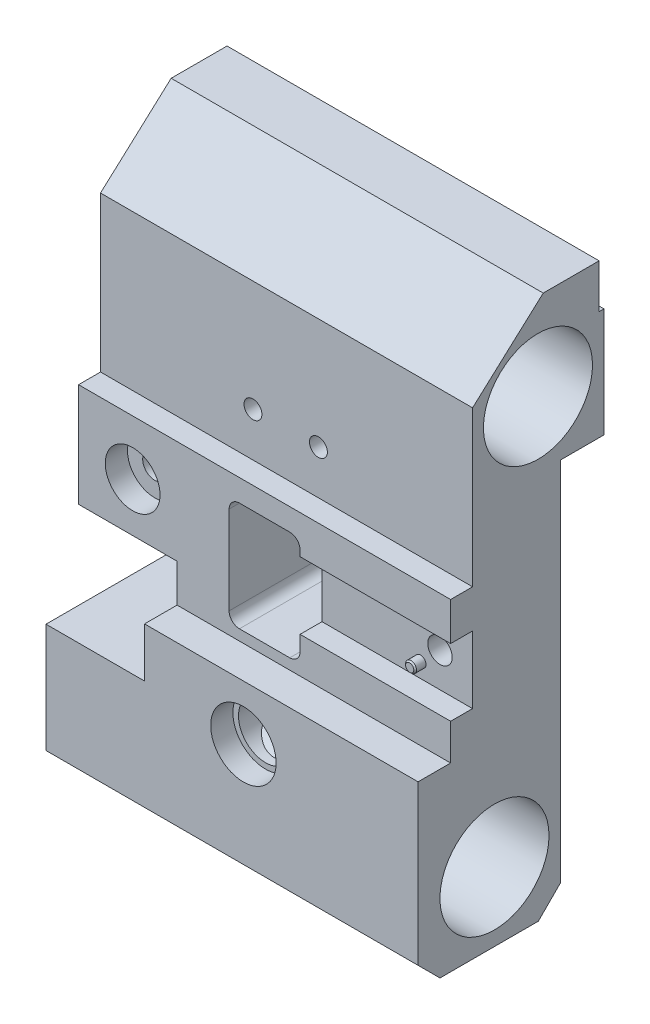
from build123d import *

# Parameters (mm, degrees)
BOSS_EXTRUDE1_DEPTH      = 54
BOSS_EXTRUDE1_DEPTH_BACK = 54
SKETCH1_R                = 15.83
SKETCH2_R                = 7.875
SKETCH2_R_2              = 2.6
SKETCH2_R_3              = 3.525
SKETCH2_R_4              = 3.55
SKETCH2_W                = 28.6
SKETCH2_H                = 25.4
CUT_EXTRUDE1_DEPTH       = 154.113939274
SKETCH3_W                = 43.7
SKETCH3_H                = 19.52
CUT_EXTRUDE2_DEPTH       = 6.36
SKETCH4_R                = 1.585
BOSS_EXTRUDE2_DEPTH      = 3.15
SKETCH10_R               = 1.585
CUT_EXTRUDE6_DEPTH       = 20
SKETCH11_R               = 5.5
SKETCH11_R_2             = 3.525
SKETCH11_R_3             = 5.42
CUT_EXTRUDE7_DEPTH       = 6.56
CHAMFER1_SIZE            = 0.4
SKETCH5_R                = 7.945
CUT_EXTRUDE3_DEPTH       = 6.44
SKETCH6_R                = 9.495
CUT_EXTRUDE4_DEPTH       = 6.44
SKETCH7_W                = 8.77
SKETCH7_H                = 34.96
BOSS_EXTRUDE3_DEPTH      = 3.1
SKETCH8_R                = 2
CUT_EXTRUDE5_DEPTH       = 15
SKETCH11_3_R             = 4.55
SKETCH11_3_R_2           = 2.6
CUT_EXTRUDE8_DEPTH       = 5.45
SKETCH12_R               = 9.475
CUT_EXTRUDE9_DEPTH       = 5.15
SKETCH13_R               = 2
CUT_EXTRUDE10_DEPTH      = 10
SKETCH14_R               = 2
CUT_EXTRUDE11_DEPTH      = 10


with BuildPart() as part:
    # Sketch1 → Boss-Extrude1 (new, two sides: drawn at the far end of the back side and taken through both)
    with BuildSketch(Plane(origin=(0, 0, 0), x_dir=(0, 0, -1), z_dir=(1, 0, 0)).offset(-BOSS_EXTRUDE1_DEPTH_BACK)):
        Polygon((14.15, 137.2), (30.37, 137.2), (30.37, 124.41), (31.79, 124.41), (31.79, 92.72), (19.1, 92.72), (19.1, -13.636038969), (12.736038969, -20), (-15.816038969, -20), (-22.18, -13.636038969), (-22.18, 32.5), (-12.73, 32.5), (-12.73, 73.61), (-6.36, 73.61), (-6.36, 118.61), align=None)
        Circle(SKETCH1_R, mode=Mode.SUBTRACT)
        with Locations((12.625, 111.985)):
            Circle(SKETCH1_R, mode=Mode.SUBTRACT)
    extrude(amount=BOSS_EXTRUDE1_DEPTH + BOSS_EXTRUDE1_DEPTH_BACK)

    # Sketch2 → Cut-Extrude1 (cut, through all)
    with BuildSketch(Plane(origin=(0, 0, -19.1), x_dir=(-1, 0, 0), z_dir=(0, 0, -1))):
        with Locations((-3.3, 16.595)):
            Circle(SKETCH2_R)
        with Locations((-9.25, 86.37)):
            Circle(SKETCH2_R_2)
        with Locations((9.75, 86.37)):
            Circle(SKETCH2_R_2)
        with Locations((38.3, 57.72)):
            Circle(SKETCH2_R_3)
        with Locations((-44.55, 52.92)):
            Circle(SKETCH2_R_4)
        with BuildLine():
            Line((-7.3, 67.2), (7.3, 67.2))
            ThreePointArc((7.3, 67.2), (9.421320344, 66.321320344), (10.3, 64.2))
            Line((10.3, 64.2), (10.3, 38.6))
            ThreePointArc((10.3, 38.6), (9.421320344, 36.478679656), (7.3, 35.6))
            Line((7.3, 35.6), (-7.3, 35.6))
            ThreePointArc((-7.3, 35.6), (-9.421320344, 36.478679656), (-10.3, 38.6))
            Line((-10.3, 38.6), (-10.3, 64.2))
            ThreePointArc((-10.3, 64.2), (-9.421320344, 66.321320344), (-7.3, 67.2))
        make_face()
        with Locations((39.7, 30.83)):
            Rectangle(SKETCH2_W, SKETCH2_H)
    extrude(amount=-CUT_EXTRUDE1_DEPTH, mode=Mode.SUBTRACT)

    # Sketch3 → Cut-Extrude2 (cut)
    with BuildSketch(Plane.XY.offset(12.73)):
        with Locations((32.15, 52.76)):
            Rectangle(SKETCH3_W, SKETCH3_H)
    extrude(amount=-CUT_EXTRUDE2_DEPTH, mode=Mode.SUBTRACT)

    # Sketch4 → Boss-Extrude2 (add)
    with BuildSketch(Plane.XY.offset(6.37)):
        with Locations((38.915, 47.335)):
            Circle(SKETCH4_R)
    extrude(amount=BOSS_EXTRUDE2_DEPTH)

    # Sketch10 → Cut-Extrude6 (cut)
    with BuildSketch(Plane(origin=(0, 0, -19.1), x_dir=(-1, 0, 0), z_dir=(0, 0, -1))):
        with Locations((-38.915, 47.335)):
            Circle(SKETCH10_R)
    extrude(amount=-CUT_EXTRUDE6_DEPTH, mode=Mode.SUBTRACT)

    # Sketch11 → Cut-Extrude7 (cut)
    # profile 1 of 2: a face of its own
    with BuildSketch(Plane(origin=(0, 0, -19.1), x_dir=(-1, 0, 0), z_dir=(0, 0, -1))):
        with Locations((38.3, 57.72)):
            Circle(SKETCH11_R)
        with Locations((38.3, 57.72)):
            Circle(SKETCH11_R_2, mode=Mode.SUBTRACT)
    # profile 2 of 2: a face of its own
    with BuildSketch(Plane(origin=(0, 0, -19.1), x_dir=(-1, 0, 0), z_dir=(0, 0, -1))):
        with Locations((-44.55, 52.92)):
            Circle(SKETCH11_R_3)
    extrude(amount=-CUT_EXTRUDE7_DEPTH, mode=Mode.SUBTRACT)

    # Chamfer1
    chamfer1_edges = [part.edges().sort_by_distance(p)[0] for p in [
        (37.33, 47.335, 9.52),
    ]]
    chamfer(chamfer1_edges, length=CHAMFER1_SIZE)

    # Sketch5 → Cut-Extrude3 (cut)
    with BuildSketch(Plane.XY.offset(12.73)):
        with Locations((-38.3, 57.72)):
            Circle(SKETCH5_R)
    extrude(amount=-CUT_EXTRUDE3_DEPTH, mode=Mode.SUBTRACT)

    # Sketch6 → Cut-Extrude4 (cut)
    with BuildSketch(Plane.XY.offset(22.18)):
        with Locations((3.3, 16.595)):
            Circle(SKETCH6_R)
    extrude(amount=-CUT_EXTRUDE4_DEPTH, mode=Mode.SUBTRACT)

    # Sketch7 → Boss-Extrude3 (add)
    with BuildSketch(Plane(origin=(0, 0, -19.1), x_dir=(-1, 0, 0), z_dir=(0, 0, -1))):
        with Locations((21.015, 16.59)):
            Rectangle(SKETCH7_W, SKETCH7_H)
    extrude(amount=BOSS_EXTRUDE3_DEPTH)

    # Sketch8 → Cut-Extrude5 (cut)
    with BuildSketch(Plane(origin=(0, 0, -22.2), x_dir=(-1, 0, 0), z_dir=(0, 0, -1))):
        with Locations((21.4, 29.135)):
            Circle(SKETCH8_R)
        with Locations((21.4, 3.82)):
            Circle(SKETCH8_R)
    extrude(amount=-CUT_EXTRUDE5_DEPTH, mode=Mode.SUBTRACT)

    # Sketch11<3> → Cut-Extrude8 (cut)
    # profile 1 of 2: a face of its own
    with BuildSketch(Plane(origin=(0, 0, -19.1), x_dir=(-1, 0, 0), z_dir=(0, 0, -1))):
        with Locations((-9.25, 86.37)):
            Circle(SKETCH11_3_R)
        with Locations((-9.25, 86.37)):
            Circle(SKETCH11_3_R_2, mode=Mode.SUBTRACT)
    # profile 2 of 2: a face of its own
    with BuildSketch(Plane(origin=(0, 0, -19.1), x_dir=(-1, 0, 0), z_dir=(0, 0, -1))):
        with Locations((9.75, 86.37)):
            Circle(SKETCH11_3_R)
        with Locations((9.75, 86.37)):
            Circle(SKETCH11_3_R_2, mode=Mode.SUBTRACT)
    extrude(amount=-CUT_EXTRUDE8_DEPTH, mode=Mode.SUBTRACT)

    # Sketch12 → Cut-Extrude9 (cut)
    with BuildSketch(Plane(origin=(0, 0, -19.1), x_dir=(-1, 0, 0), z_dir=(0, 0, -1))):
        with Locations((-3.3, 16.595)):
            Circle(SKETCH12_R)
    extrude(amount=-CUT_EXTRUDE9_DEPTH, mode=Mode.SUBTRACT)

    # Sketch13 → Cut-Extrude10 (cut)
    with BuildSketch(Plane(origin=(0, 0, -19.1), x_dir=(-1, 0, 0), z_dir=(0, 0, -1))):
        with Locations((-13.5, 73.72)):
            Circle(SKETCH13_R)
        with Locations((13.2, 73.72)):
            Circle(SKETCH13_R)
        with Locations((-13.5, 41.72)):
            Circle(SKETCH13_R)
        with Locations((13.2, 41.72)):
            Circle(SKETCH13_R)
        with Locations((20.3, 41.72)):
            Circle(SKETCH13_R)
        with Locations((-21, 41.92)):
            Circle(SKETCH13_R)
    extrude(amount=-CUT_EXTRUDE10_DEPTH, mode=Mode.SUBTRACT)

    # Sketch14 → Cut-Extrude11 (cut)
    with BuildSketch(Plane(origin=(0, 0, -30.37), x_dir=(-1, 0, 0), z_dir=(0, 0, -1))):
        with Locations((-0.2, 130.91)):
            Circle(SKETCH14_R)
    extrude(amount=-CUT_EXTRUDE11_DEPTH, mode=Mode.SUBTRACT)


solid = part.part
